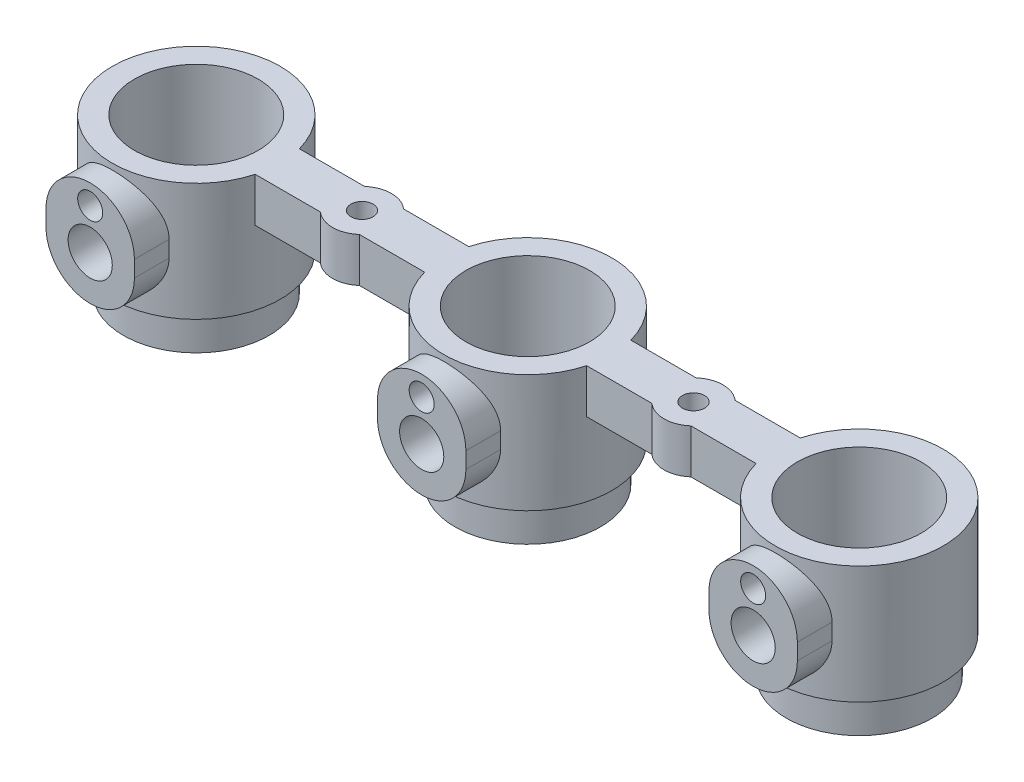
from build123d import *

# Parameters (mm, degrees)
SKETCH2_R            = 1.5
BOSS_EXTRUDE1_DEPTH  = 10
SKETCH9_W            = 166.38618034
SKETCH9_H            = 90.507519626
CUT_EXTRUDE1_DEPTH   = 4
SKETCH17_R           = 3
SKETCH17_R_2         = 1.7
BOSS_EXTRUDE10_DEPTH = 3
CUT_EXTRUDE8_START   = -10
SKETCH17_3_R         = 1.7
CUT_EXTRUDE8_DEPTH   = 10
LPATTERN13_COUNT     = 2
LPATTERN13_PITCH     = 45
LPATTERN14_COUNT     = 2
LPATTERN14_PITCH     = 45


with BuildPart() as part:
    # Sketch1 → Revolve2 (revolve)
    with BuildSketch(Plane.XY):
        Polygon((9.9, 12.918015055), (11.4, 12.918015055), (11.4, 32.918015055), (8.4, 32.918015055), (8.4, 7.918015055), (9.9, 7.918015055), align=None)
    revolve(axis=Axis((0, 51.150081367, 0), (0, -1, 0)))



with BuildPart() as body_2:
    # Sketch1<5> → Revolve3 (revolve)
    with BuildSketch(Plane.XY):
        Polygon((-35.1, 12.918015055), (-33.6, 12.918015055), (-33.6, 32.918015055), (-36.6, 32.918015055), (-36.6, 7.918015055), (-35.1, 7.918015055), align=None)
    revolve(axis=Axis((-45, 51.150081367, 0), (0, -1, 0)))


with BuildPart() as body_3:
    # Sketch1<6> → Revolve4 (revolve)
    with BuildSketch(Plane.XY):
        Polygon((56.4, 32.918015055), (53.4, 32.918015055), (53.4, 7.918015055), (54.9, 7.918015055), (54.9, 12.918015055), (56.4, 12.918015055), align=None)
    revolve(axis=Axis((45, 51.150081367, 0), (0, -1, 0)))


with BuildPart() as part_1:
    add(part.part)

    add(body_2.part)  # Boss-Extrude1 merges body 2

    add(body_3.part)  # Boss-Extrude1 merges body 3
    # Sketch2 → Boss-Extrude1 (add)
    # profile 1 of 2: a face of its own
    with BuildSketch(Plane(origin=(0, 32.918015055, 0), x_dir=(1, 0, 0), z_dir=(0, 1, 0))):
        with BuildLine():
            Line((10.998181668, 3), (10.998181668, -3))
            Line((10.998181668, -3), (19.854248689, -3))
            ThreePointArc((19.854248689, -3), (22.5, -4), (25.145751311, -3))
            Line((25.145751311, -3), (34.001818332, -3))
            Line((34.001818332, -3), (34.001818332, 3))
            Line((34.001818332, 3), (25.145751311, 3))
            ThreePointArc((25.145751311, 3), (22.5, 4), (19.854248689, 3))
            Line((19.854248689, 3), (10.998181668, 3))
        make_face()
        with Locations((22.5, 0)):
            Circle(SKETCH2_R, mode=Mode.SUBTRACT)
    # profile 2 of 2: a face of its own
    with BuildSketch(Plane(origin=(0, 32.918015055, 0), x_dir=(1, 0, 0), z_dir=(0, 1, 0))):
        with BuildLine():
            Line((-25.145751311, 3), (-34.001818332, 3))
            Line((-34.001818332, 3), (-34.001818332, -3))
            Line((-34.001818332, -3), (-25.145751311, -3))
            ThreePointArc((-25.145751311, -3), (-22.5, -4), (-19.854248689, -3))
            Line((-19.854248689, -3), (-10.998181668, -3))
            Line((-10.998181668, -3), (-10.998181668, 3))
            Line((-10.998181668, 3), (-19.854248689, 3))
            ThreePointArc((-19.854248689, 3), (-22.5, 4), (-25.145751311, 3))
        make_face()
        with Locations((-22.5, 0)):
            Circle(SKETCH2_R, mode=Mode.SUBTRACT)
    extrude(amount=-BOSS_EXTRUDE1_DEPTH)

    # Sketch9 → Cut-Extrude1 (cut)
    with BuildSketch(Plane(origin=(0, 32.918015055, 0), x_dir=(1, 0, 0), z_dir=(0, 1, 0))):
        with Locations((1.025387307, -1.43554223)):
            Rectangle(SKETCH9_W, SKETCH9_H)
    extrude(amount=-CUT_EXTRUDE1_DEPTH, mode=Mode.SUBTRACT)

    # Sketch17 → Boss-Extrude10 (add, symmetric)
    with BuildSketch(Plane.XY.offset(11.4)):
        with BuildLine():
            ThreePointArc((-6, 19.918015055), (0, 13.918015055), (6, 19.918015055))
            Line((6, 19.918015055), (6, 22.118015055))
            ThreePointArc((6, 22.118015055), (0, 28.118015055), (-6, 22.118015055))
            Line((-6, 22.118015055), (-6, 19.918015055))
        make_face()
        with Locations((0, 19.918015055)):
            Circle(SKETCH17_R, mode=Mode.SUBTRACT)
        with Locations((0, 25.418015055)):
            Circle(SKETCH17_R_2, mode=Mode.SUBTRACT)
    boss_extrude10 = extrude(amount=BOSS_EXTRUDE10_DEPTH, both=True)

    # Sketch17<3> → Cut-Extrude8 (cut)
    with BuildSketch(Plane.XY.offset(11.4).offset(CUT_EXTRUDE8_START)):
        with BuildLine():
            ThreePointArc((-0.747217428, 22.823469601), (0, 16.918015055), (0.747217428, 22.823469601))
            ThreePointArc((0.747217428, 22.823469601), (0, 22.718015055), (-0.747217428, 22.823469601))
        make_face()
        with Locations((0, 25.418015055)):
            Circle(SKETCH17_3_R)
    cut_extrude8 = extrude(amount=CUT_EXTRUDE8_DEPTH, mode=Mode.SUBTRACT)

    # LPattern13: Boss-Extrude10, Cut-Extrude8 ×2
    with Locations(*[(i * LPATTERN13_PITCH, 0, 0) for i in range(1, LPATTERN13_COUNT)]):
        add(boss_extrude10)
        add(cut_extrude8, mode=Mode.SUBTRACT)

    # LPattern14: Boss-Extrude10, Cut-Extrude8 ×2
    with Locations(*[(-i * LPATTERN14_PITCH, 0, 0) for i in range(1, LPATTERN14_COUNT)]):
        add(boss_extrude10)
        add(cut_extrude8, mode=Mode.SUBTRACT)


solid = part_1.part
